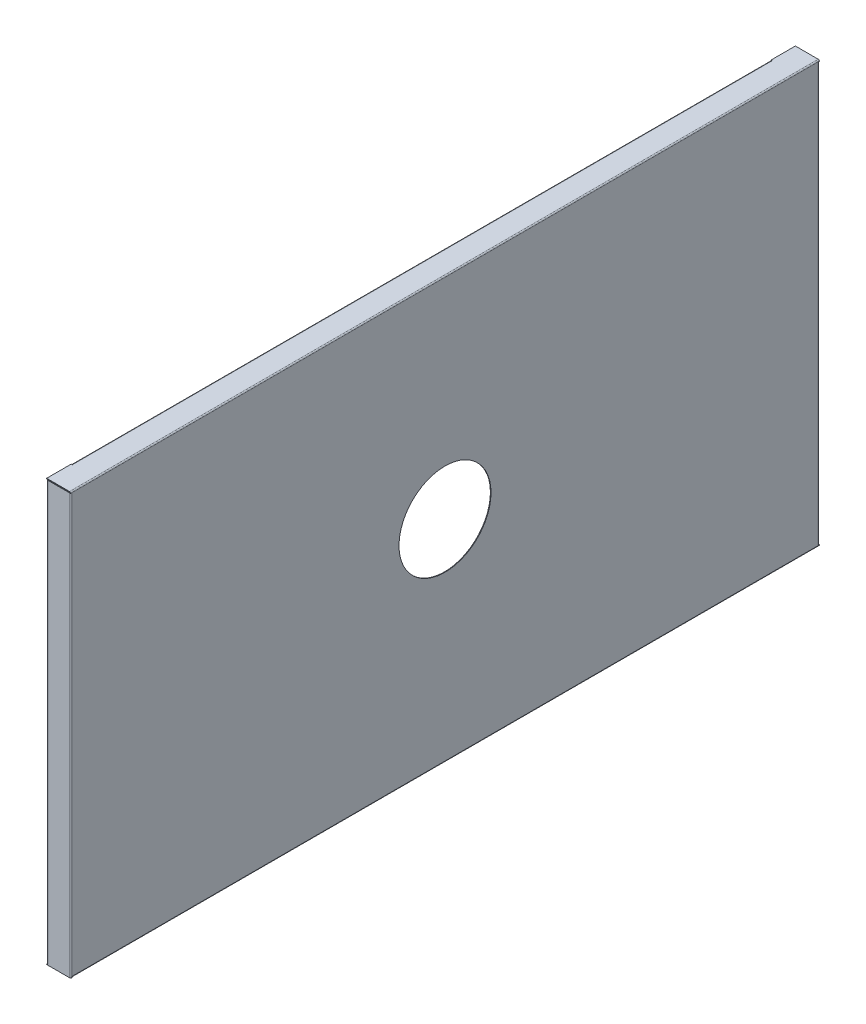
from build123d import *

# Parameters (mm, degrees)
SKETCH1_W                     = 935.9
SKETCH1_H                     = 526.4
SKETCH1_R                     = 57.5
BASE_FLANGE1_DEPTH            = 0.7366
EDGE_FLANGE1_STRIP_W          = 4.4196
EDGE_FLANGE1_STRIP_H          = 0.7366
EDGE_FLANGE1_STRIP_CUT_DEPTH  = 935.9
EDGE_FLANGE1_DEPTH            = 935.9
EDGE_FLANGE2_STRIP_W          = 4.4196
EDGE_FLANGE2_STRIP_H          = 0.7366
EDGE_FLANGE2_STRIP_CUT_DEPTH  = 524.9268
EDGE_FLANGE2_DEPTH            = 524.9268
EDGE_FLANGE3_STRIP_W          = 4.4196
EDGE_FLANGE3_STRIP_H          = 0.7366
EDGE_FLANGE3_STRIP_CUT_DEPTH  = 934.4268
EDGE_FLANGE3_DEPTH            = 934.4268
EDGE_FLANGE4_STRIP_W          = 4.4196
EDGE_FLANGE4_STRIP_H          = 0.7366
EDGE_FLANGE4_STRIP_CUT_DEPTH  = 523.4536
EDGE_FLANGE4_DEPTH            = 523.4536
EDGE_FLANGE5_STRIP_W          = 4.4196
EDGE_FLANGE5_STRIP_H          = 0.7366
EDGE_FLANGE5_STRIP_CUT_DEPTH  = 874.0268
EDGE_FLANGE5_RELIEF_W         = 4.7879
EDGE_FLANGE5_RELIEF_H         = 0.3683
EDGE_FLANGE5_RELIEF_CUT_DEPTH = 0.7366
EDGE_FLANGE5_DEPTH            = 874.0268
EDGE_FLANGE6_STRIP_W          = 4.4196
EDGE_FLANGE6_STRIP_H          = 0.7366
EDGE_FLANGE6_STRIP_CUT_DEPTH  = 874.0268
EDGE_FLANGE6_RELIEF_W         = 4.7879
EDGE_FLANGE6_RELIEF_H         = 0.3683
EDGE_FLANGE6_RELIEF_CUT_DEPTH = 0.7366
EDGE_FLANGE6_DEPTH            = 874.0268
EDGE_FLANGE7_STRIP_W          = 4.4196
EDGE_FLANGE7_STRIP_H          = 0.7366
EDGE_FLANGE7_STRIP_CUT_DEPTH  = 523.4536
EDGE_FLANGE7_DEPTH            = 523.4536
EDGE_FLANGE8_STRIP_W          = 4.4196
EDGE_FLANGE8_STRIP_H          = 0.7366
EDGE_FLANGE8_STRIP_CUT_DEPTH  = 523.9902
EDGE_FLANGE8_RELIEF_W         = 4.7879
EDGE_FLANGE8_RELIEF_H         = 0.3683
EDGE_FLANGE8_RELIEF_CUT_DEPTH = 0.7366
EDGE_FLANGE8_DEPTH            = 523.9902


# Sheet-metal steps are written as plain solids
with BuildPart() as part:
    # Sketch1 → Base-Flange1 (new body)
    with BuildSketch(Plane(origin=(0, 0, 0), x_dir=(0, 0, -1), z_dir=(1, 0, 0))):
        Rectangle(SKETCH1_W, SKETCH1_H)
        Circle(SKETCH1_R, mode=Mode.SUBTRACT)
    extrude(amount=-BASE_FLANGE1_DEPTH)

    # Edge-Flange1 strip (across the edge) → Edge-Flange1 strip cut (cut)
    with BuildSketch(Plane(origin=(-0.7366, 263.2, 467.95), x_dir=(0, -1, 0), z_dir=(0, 0, -1))):
        with Locations((-0.7366, -0.3683)):
            Rectangle(EDGE_FLANGE1_STRIP_W, EDGE_FLANGE1_STRIP_H)
    extrude(amount=EDGE_FLANGE1_STRIP_CUT_DEPTH, mode=Mode.SUBTRACT)

    # Edge-Flange1 section (across the edge) → Edge-Flange1 (add)
    with BuildSketch(Plane(origin=(-0.7366, 263.2, 467.95), x_dir=(0, -1, 0), z_dir=(0, 0, -1))):
        with BuildLine():
            Line((0, 0.7366), (0, 29.2634))
            Line((0, 29.2634), (0.7366, 29.2634))
            Line((0.7366, 29.2634), (0.7366, 0.7366))
            ThreePointArc((0.7366, 0.7366), (0.952345145, 0.215745145), (1.4732, 0))
            Line((1.4732, 0), (1.4732, -0.7366))
            ThreePointArc((1.4732, -0.7366), (0.43149029, -0.30510971), (0, 0.7366))
        make_face()
    extrude(amount=EDGE_FLANGE1_DEPTH)

    # Edge-Flange2 strip (across the edge) → Edge-Flange2 strip cut (cut)
    with BuildSketch(Plane(origin=(-0.7366, -263.2, 467.95), x_dir=(0, 0, -1), z_dir=(0, 1, 0))):
        with Locations((-0.7366, -0.3683)):
            Rectangle(EDGE_FLANGE2_STRIP_W, EDGE_FLANGE2_STRIP_H)
    extrude(amount=EDGE_FLANGE2_STRIP_CUT_DEPTH, mode=Mode.SUBTRACT)

    # Edge-Flange2 section (across the edge) → Edge-Flange2 (add)
    with BuildSketch(Plane(origin=(-0.7366, -263.2, 467.95), x_dir=(0, 0, -1), z_dir=(0, 1, 0))):
        with BuildLine():
            Line((0, 0.7366), (0, 29.2634))
            Line((0, 29.2634), (0.7366, 29.2634))
            Line((0.7366, 29.2634), (0.7366, 0.7366))
            ThreePointArc((0.7366, 0.7366), (0.952345145, 0.215745145), (1.4732, 0))
            Line((1.4732, 0), (1.4732, -0.7366))
            ThreePointArc((1.4732, -0.7366), (0.43149029, -0.30510971), (0, 0.7366))
        make_face()
    extrude(amount=EDGE_FLANGE2_DEPTH)

    # Edge-Flange3 strip (across the edge) → Edge-Flange3 strip cut (cut)
    with BuildSketch(Plane(origin=(-0.7366, -263.2, -467.95), x_dir=(0, 1, 0), z_dir=(0, 0, 1))):
        with Locations((-0.7366, -0.3683)):
            Rectangle(EDGE_FLANGE3_STRIP_W, EDGE_FLANGE3_STRIP_H)
    extrude(amount=EDGE_FLANGE3_STRIP_CUT_DEPTH, mode=Mode.SUBTRACT)

    # Edge-Flange3 section (across the edge) → Edge-Flange3 (add)
    with BuildSketch(Plane(origin=(-0.7366, -263.2, -467.95), x_dir=(0, 1, 0), z_dir=(0, 0, 1))):
        with BuildLine():
            Line((0, 0.7366), (0, 29.2634))
            Line((0, 29.2634), (0.7366, 29.2634))
            Line((0.7366, 29.2634), (0.7366, 0.7366))
            ThreePointArc((0.7366, 0.7366), (0.952345145, 0.215745145), (1.4732, 0))
            Line((1.4732, 0), (1.4732, -0.7366))
            ThreePointArc((1.4732, -0.7366), (0.43149029, -0.30510971), (0, 0.7366))
        make_face()
    extrude(amount=EDGE_FLANGE3_DEPTH)

    # Edge-Flange4 strip (across the edge) → Edge-Flange4 strip cut (cut)
    with BuildSketch(Plane(origin=(-0.7366, 261.7268, -467.95), x_dir=(0, 0, 1), z_dir=(0, -1, 0))):
        with Locations((-0.7366, -0.3683)):
            Rectangle(EDGE_FLANGE4_STRIP_W, EDGE_FLANGE4_STRIP_H)
    extrude(amount=EDGE_FLANGE4_STRIP_CUT_DEPTH, mode=Mode.SUBTRACT)

    # Edge-Flange4 section (across the edge) → Edge-Flange4 (add)
    with BuildSketch(Plane(origin=(-0.7366, 261.7268, -467.95), x_dir=(0, 0, 1), z_dir=(0, -1, 0))):
        with BuildLine():
            Line((0, 0.7366), (0, 29.2634))
            Line((0, 29.2634), (0.7366, 29.2634))
            Line((0.7366, 29.2634), (0.7366, 0.7366))
            ThreePointArc((0.7366, 0.7366), (0.952345145, 0.215745145), (1.4732, 0))
            Line((1.4732, 0), (1.4732, -0.7366))
            ThreePointArc((1.4732, -0.7366), (0.43149029, -0.30510971), (0, 0.7366))
        make_face()
    extrude(amount=EDGE_FLANGE4_DEPTH)

    # Edge-Flange5 strip (across the edge) → Edge-Flange5 strip cut (cut)
    with BuildSketch(Plane(origin=(-30, 262.4634, 437.0134), x_dir=(1, 0, 0), z_dir=(0, 0, -1))):
        with Locations((-0.7366, -0.3683)):
            Rectangle(EDGE_FLANGE5_STRIP_W, EDGE_FLANGE5_STRIP_H)
    extrude(amount=EDGE_FLANGE5_STRIP_CUT_DEPTH, mode=Mode.SUBTRACT)

    # Edge-Flange5 relief (on the sheet) → Edge-Flange5 relief cut (cut)
    with BuildSketch(Plane(origin=(-28.5268, 262.4634, 437.0134), x_dir=(1, 0, 0), z_dir=(0, -1, 0))):
        with Locations((-2.02565, 0.18415)):
            Rectangle(EDGE_FLANGE5_RELIEF_W, EDGE_FLANGE5_RELIEF_H)
        with Locations((-2.02565, -874.21095)):
            Rectangle(EDGE_FLANGE5_RELIEF_W, EDGE_FLANGE5_RELIEF_H)
    extrude(amount=-EDGE_FLANGE5_RELIEF_CUT_DEPTH, mode=Mode.SUBTRACT)

    # Edge-Flange5 section (across the edge) → Edge-Flange5 (add)
    with BuildSketch(Plane(origin=(-30, 262.4634, 437.0134), x_dir=(1, 0, 0), z_dir=(0, 0, -1))):
        with BuildLine():
            Line((0, 0.7366), (0, 29.2634))
            Line((0, 29.2634), (0.7366, 29.2634))
            Line((0.7366, 29.2634), (0.7366, 0.7366))
            ThreePointArc((0.7366, 0.7366), (0.952345145, 0.215745145), (1.4732, 0))
            Line((1.4732, 0), (1.4732, -0.7366))
            ThreePointArc((1.4732, -0.7366), (0.43149029, -0.30510971), (0, 0.7366))
        make_face()
    extrude(amount=EDGE_FLANGE5_DEPTH)

    # Edge-Flange6 strip (across the edge) → Edge-Flange6 strip cut (cut)
    with BuildSketch(Plane(origin=(-30, -262.4634, -437.0134), x_dir=(1, 0, 0), z_dir=(0, 0, 1))):
        with Locations((-0.7366, -0.3683)):
            Rectangle(EDGE_FLANGE6_STRIP_W, EDGE_FLANGE6_STRIP_H)
    extrude(amount=EDGE_FLANGE6_STRIP_CUT_DEPTH, mode=Mode.SUBTRACT)

    # Edge-Flange6 relief (on the sheet) → Edge-Flange6 relief cut (cut)
    with BuildSketch(Plane(origin=(-28.5268, -262.4634, -437.0134), x_dir=(1, 0, 0), z_dir=(0, 1, 0))):
        with Locations((-2.02565, 0.18415)):
            Rectangle(EDGE_FLANGE6_RELIEF_W, EDGE_FLANGE6_RELIEF_H)
        with Locations((-2.02565, -874.21095)):
            Rectangle(EDGE_FLANGE6_RELIEF_W, EDGE_FLANGE6_RELIEF_H)
    extrude(amount=-EDGE_FLANGE6_RELIEF_CUT_DEPTH, mode=Mode.SUBTRACT)

    # Edge-Flange6 section (across the edge) → Edge-Flange6 (add)
    with BuildSketch(Plane(origin=(-30, -262.4634, -437.0134), x_dir=(1, 0, 0), z_dir=(0, 0, 1))):
        with BuildLine():
            Line((0, 0.7366), (0, 29.2634))
            Line((0, 29.2634), (0.7366, 29.2634))
            Line((0.7366, 29.2634), (0.7366, 0.7366))
            ThreePointArc((0.7366, 0.7366), (0.952345145, 0.215745145), (1.4732, 0))
            Line((1.4732, 0), (1.4732, -0.7366))
            ThreePointArc((1.4732, -0.7366), (0.43149029, -0.30510971), (0, 0.7366))
        make_face()
    extrude(amount=EDGE_FLANGE6_DEPTH)

    # Edge-Flange7 strip (across the edge) → Edge-Flange7 strip cut (cut)
    with BuildSketch(Plane(origin=(-30, 261.7268, -467.2134), x_dir=(1, 0, 0), z_dir=(0, -1, 0))):
        with Locations((-0.7366, -0.3683)):
            Rectangle(EDGE_FLANGE7_STRIP_W, EDGE_FLANGE7_STRIP_H)
    extrude(amount=EDGE_FLANGE7_STRIP_CUT_DEPTH, mode=Mode.SUBTRACT)

    # Edge-Flange7 section (across the edge) → Edge-Flange7 (add)
    with BuildSketch(Plane(origin=(-30, 261.7268, -467.2134), x_dir=(1, 0, 0), z_dir=(0, -1, 0))):
        with BuildLine():
            Line((0, 0.7366), (0, 29.2634))
            Line((0, 29.2634), (0.7366, 29.2634))
            Line((0.7366, 29.2634), (0.7366, 0.7366))
            ThreePointArc((0.7366, 0.7366), (0.952345145, 0.215745145), (1.4732, 0))
            Line((1.4732, 0), (1.4732, -0.7366))
            ThreePointArc((1.4732, -0.7366), (0.43149029, -0.30510971), (0, 0.7366))
        make_face()
    extrude(amount=EDGE_FLANGE7_DEPTH)

    # Edge-Flange8 strip (across the edge) → Edge-Flange8 strip cut (cut)
    with BuildSketch(Plane(origin=(-30, -262.2634, 467.2134), x_dir=(1, 0, 0), z_dir=(0, 1, 0))):
        with Locations((-0.7366, -0.3683)):
            Rectangle(EDGE_FLANGE8_STRIP_W, EDGE_FLANGE8_STRIP_H)
    extrude(amount=EDGE_FLANGE8_STRIP_CUT_DEPTH, mode=Mode.SUBTRACT)

    # Edge-Flange8 relief (on the sheet) → Edge-Flange8 relief cut (cut)
    with BuildSketch(Plane(origin=(-28.5268, -262.2634, 467.2134), x_dir=(1, 0, 0), z_dir=(0, 0, -1))):
        with Locations((-2.02565, 0.18415)):
            Rectangle(EDGE_FLANGE8_RELIEF_W, EDGE_FLANGE8_RELIEF_H)
    extrude(amount=-EDGE_FLANGE8_RELIEF_CUT_DEPTH, mode=Mode.SUBTRACT)

    # Edge-Flange8 section (across the edge) → Edge-Flange8 (add)
    with BuildSketch(Plane(origin=(-30, -262.2634, 467.2134), x_dir=(1, 0, 0), z_dir=(0, 1, 0))):
        with BuildLine():
            Line((0, 0.7366), (0, 29.2634))
            Line((0, 29.2634), (0.7366, 29.2634))
            Line((0.7366, 29.2634), (0.7366, 0.7366))
            ThreePointArc((0.7366, 0.7366), (0.952345145, 0.215745145), (1.4732, 0))
            Line((1.4732, 0), (1.4732, -0.7366))
            ThreePointArc((1.4732, -0.7366), (0.43149029, -0.30510971), (0, 0.7366))
        make_face()
    extrude(amount=EDGE_FLANGE8_DEPTH)


solid = part.part
